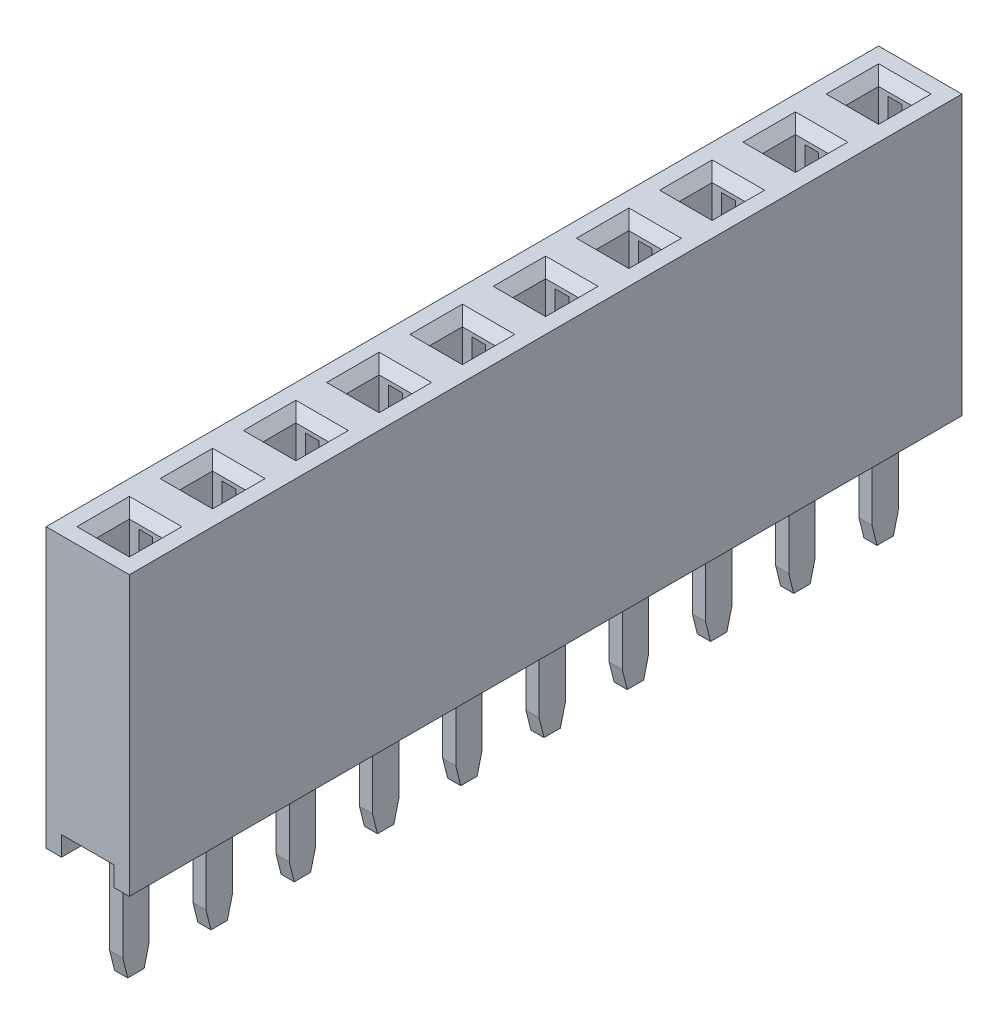
from build123d import *

# Parameters (mm, degrees)
DODANIE_WYCI_GNI_CIE1_DEPTH  = 2.54
SZKIC2_W                     = 1
SZKIC2_H                     = 1
WYTNIJ_WYCI_GNI_CIE1_DEPTH   = 6.5
SFAZOWANIE1_SIZE             = 0.3
SZKIC3_W                     = 0.42
SZKIC3_H                     = 2
WYTNIJ_WYCI_GNI_CIE2_DEPTH   = 7.48
F_1_0_START                  = 5.308321595
F_1_0_METAL_DEPTH            = 0.4
OBIEKT_PRZENIE_KOPIUJ4_ANGLE = 90
SZYK_LINIOWY1_COUNT          = 10
SZYK_LINIOWY1_PITCH          = 2.54


with BuildPart() as part:
    # Szkic1 → Dodanie-wyciągnięcie1 (new body)
    with BuildSketch(Plane.XY):
        Polygon((-60.643223432, 20.119077877), (-60.173223432, 20.119077877), (-60.173223432, 20.719077877), (-58.573223432, 20.719077877), (-58.573223432, 20.119077877), (-58.103223432, 20.119077877), (-58.103223432, 28.619077877), (-60.643223432, 28.619077877), align=None)
    extrude(amount=DODANIE_WYCI_GNI_CIE1_DEPTH)

    # Szkic2 → Wytnij-wyciągnięcie1 (cut)
    with BuildSketch(Plane(origin=(0, 28.619077877, 0), x_dir=(1, 0, 0), z_dir=(0, 1, 0))):
        with Locations((-59.373223432, -1.27)):
            Rectangle(SZKIC2_W, SZKIC2_H)
    extrude(amount=-WYTNIJ_WYCI_GNI_CIE1_DEPTH, mode=Mode.SUBTRACT)

    # Sfazowanie1
    sfazowanie1_edges = [part.edges().sort_by_distance(p)[0] for p in [
        (-59.873223432, 28.619077877, 1.27),
        (-59.373223432, 28.619077877, 1.77),
        (-58.873223432, 28.619077877, 1.27),
        (-59.373223432, 28.619077877, 0.77),
    ]]
    chamfer(sfazowanie1_edges, length=SFAZOWANIE1_SIZE)

    # Szkic3 → Wytnij-wyciągnięcie2 (cut)
    with BuildSketch(Plane.XZ.offset(-20.719077877)):
        with Locations((-59.373223432, 1.27)):
            Rectangle(SZKIC3_W, SZKIC3_H)
    extrude(amount=-WYTNIJ_WYCI_GNI_CIE2_DEPTH, mode=Mode.SUBTRACT)


with BuildPart() as body_2:
    # 1.0 metal: read off the stored shape, not the designer's step
    # 1.0 metal outline → 1.0 metal (new body)
    with BuildSketch(Plane.XY.offset(F_1_0_START)):
        with BuildLine():
            Line((-59.545144592, 19.33476682), (-59.045144592, 19.33476682))
            Line((-59.045144592, 19.33476682), (-58.895144592, 19.93476682))
            Line((-58.895144592, 19.93476682), (-58.895144592, 23.13476682))
            Line((-58.895144592, 23.13476682), (-58.695144592, 23.13476682))
            Line((-58.695144592, 23.13476682), (-58.295144592, 23.38476682))
            Line((-58.295144592, 23.38476682), (-58.295144592, 25.13476682))
            Line((-58.295144592, 25.13476682), (-58.481811258, 28.63476682))
            Line((-58.481811258, 28.63476682), (-58.845144592, 29.28476682))
            Line((-58.845144592, 29.28476682), (-58.995144592, 28.88476682))
            Line((-58.995144592, 28.88476682), (-58.795144592, 25.13476682))
            Line((-58.795144592, 25.13476682), (-58.795144592, 24.23476682))
            ThreePointArc((-58.795144592, 24.23476682), (-59.295144592, 23.73476682), (-59.795144592, 24.23476682))
            Line((-59.795144592, 24.23476682), (-59.795144592, 25.13476682))
            Line((-59.795144592, 25.13476682), (-59.595144592, 28.88476682))
            Line((-59.595144592, 28.88476682), (-59.745144592, 29.28476682))
            Line((-59.745144592, 29.28476682), (-60.108477925, 28.63476682))
            Line((-60.108477925, 28.63476682), (-60.295144592, 25.13476682))
            Line((-60.295144592, 25.13476682), (-60.295144592, 23.38476682))
            Line((-60.295144592, 23.38476682), (-59.895144592, 23.13476682))
            Line((-59.895144592, 23.13476682), (-59.695144592, 23.13476682))
            Line((-59.695144592, 23.13476682), (-59.695144592, 19.93476682))
            Line((-59.695144592, 19.93476682), (-59.545144592, 19.33476682))
        make_face()
    extrude(amount=F_1_0_METAL_DEPTH)


with BuildPart() as body_2_1:
    # Obiekt-Przenieś/Kopiuj4: read off the stored shape, not the designer's step
    # Obiekt-Przenieś/Kopiuj4: moved
    add(body_2.part.moved(Location((58.0251446, -2.4156889, -64.881545))).rotate(Axis((0, 0, 0), (0, 1, 0)), OBIEKT_PRZENIE_KOPIUJ4_ANGLE))


with BuildPart() as szyk_liniowy1_1:
    # Szyk liniowy1: pattern copy
    add(part.part.moved(Location(Vector(0, 0, -1) * (1 * SZYK_LINIOWY1_PITCH))))


with BuildPart() as szyk_liniowy1_2:
    # Szyk liniowy1: pattern copy
    add(part.part.moved(Location(Vector(0, 0, -1) * (2 * SZYK_LINIOWY1_PITCH))))


with BuildPart() as szyk_liniowy1_3:
    # Szyk liniowy1: pattern copy
    add(part.part.moved(Location(Vector(0, 0, -1) * (3 * SZYK_LINIOWY1_PITCH))))


with BuildPart() as szyk_liniowy1_4:
    # Szyk liniowy1: pattern copy
    add(part.part.moved(Location(Vector(0, 0, -1) * (4 * SZYK_LINIOWY1_PITCH))))


with BuildPart() as szyk_liniowy1_5:
    # Szyk liniowy1: pattern copy
    add(part.part.moved(Location(Vector(0, 0, -1) * (5 * SZYK_LINIOWY1_PITCH))))


with BuildPart() as szyk_liniowy1_6:
    # Szyk liniowy1: pattern copy
    add(part.part.moved(Location(Vector(0, 0, -1) * (6 * SZYK_LINIOWY1_PITCH))))


with BuildPart() as szyk_liniowy1_7:
    # Szyk liniowy1: pattern copy
    add(part.part.moved(Location(Vector(0, 0, -1) * (7 * SZYK_LINIOWY1_PITCH))))


with BuildPart() as szyk_liniowy1_8:
    # Szyk liniowy1: pattern copy
    add(part.part.moved(Location(Vector(0, 0, -1) * (8 * SZYK_LINIOWY1_PITCH))))


with BuildPart() as szyk_liniowy1_9:
    # Szyk liniowy1: pattern copy
    add(part.part.moved(Location(Vector(0, 0, -1) * (9 * SZYK_LINIOWY1_PITCH))))


with BuildPart() as szyk_liniowy1_10:
    # Szyk liniowy1: pattern copy
    add(body_2_1.part.moved(Location(Vector(0, 0, -1) * (1 * SZYK_LINIOWY1_PITCH))))


with BuildPart() as szyk_liniowy1_11:
    # Szyk liniowy1: pattern copy
    add(body_2_1.part.moved(Location(Vector(0, 0, -1) * (2 * SZYK_LINIOWY1_PITCH))))


with BuildPart() as szyk_liniowy1_12:
    # Szyk liniowy1: pattern copy
    add(body_2_1.part.moved(Location(Vector(0, 0, -1) * (3 * SZYK_LINIOWY1_PITCH))))


with BuildPart() as szyk_liniowy1_13:
    # Szyk liniowy1: pattern copy
    add(body_2_1.part.moved(Location(Vector(0, 0, -1) * (4 * SZYK_LINIOWY1_PITCH))))


with BuildPart() as szyk_liniowy1_14:
    # Szyk liniowy1: pattern copy
    add(body_2_1.part.moved(Location(Vector(0, 0, -1) * (5 * SZYK_LINIOWY1_PITCH))))


with BuildPart() as szyk_liniowy1_15:
    # Szyk liniowy1: pattern copy
    add(body_2_1.part.moved(Location(Vector(0, 0, -1) * (6 * SZYK_LINIOWY1_PITCH))))


with BuildPart() as szyk_liniowy1_16:
    # Szyk liniowy1: pattern copy
    add(body_2_1.part.moved(Location(Vector(0, 0, -1) * (7 * SZYK_LINIOWY1_PITCH))))


with BuildPart() as szyk_liniowy1_17:
    # Szyk liniowy1: pattern copy
    add(body_2_1.part.moved(Location(Vector(0, 0, -1) * (8 * SZYK_LINIOWY1_PITCH))))


with BuildPart() as szyk_liniowy1_18:
    # Szyk liniowy1: pattern copy
    add(body_2_1.part.moved(Location(Vector(0, 0, -1) * (9 * SZYK_LINIOWY1_PITCH))))


with BuildPart() as part_1:
    add(part.part)

    # Połącz1: union Szyk liniowy1_1, Szyk liniowy1_2, Szyk liniowy1_3, Szyk liniowy1_4, Szyk liniowy1_5, Szyk liniowy1_6, Szyk liniowy1_7, Szyk liniowy1_8, Szyk liniowy1_9
    add(szyk_liniowy1_1.part)
    add(szyk_liniowy1_2.part)
    add(szyk_liniowy1_3.part)
    add(szyk_liniowy1_4.part)
    add(szyk_liniowy1_5.part)
    add(szyk_liniowy1_6.part)
    add(szyk_liniowy1_7.part)
    add(szyk_liniowy1_8.part)
    add(szyk_liniowy1_9.part)


solid = Compound([body_2_1.part, szyk_liniowy1_10.part, szyk_liniowy1_11.part, szyk_liniowy1_12.part, szyk_liniowy1_13.part, szyk_liniowy1_14.part, szyk_liniowy1_15.part, szyk_liniowy1_16.part, szyk_liniowy1_17.part, szyk_liniowy1_18.part, part_1.part])
